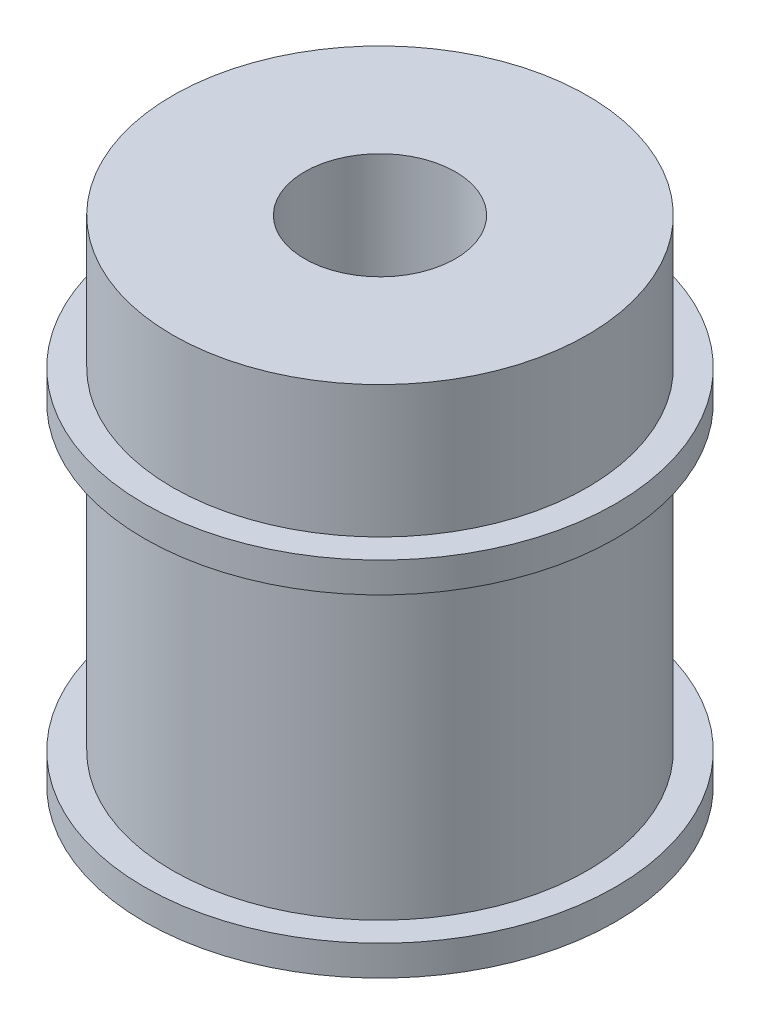
from build123d import *

# Parameters (mm, degrees)
SKETCH1_R           = 12.5
BOSS_EXTRUDE1_DEPTH = 1.6
SKETCH2_R           = 11
BOSS_EXTRUDE2_DEPTH = 16
SKETCH3_R           = 12.5
BOSS_EXTRUDE3_DEPTH = 1.6
SKETCH4_R           = 11
BOSS_EXTRUDE4_DEPTH = 7
SKETCH5_R           = 4
CUT_EXTRUDE1_DEPTH  = 32.606012086


with BuildPart() as part:
    # Sketch1 → Boss-Extrude1 (new body)
    with BuildSketch(Plane(origin=(0, 0, 0), x_dir=(1, 0, 0), z_dir=(0, 1, 0))):
        Circle(SKETCH1_R)
    extrude(amount=BOSS_EXTRUDE1_DEPTH)

    # Sketch2 → Boss-Extrude2 (add)
    with BuildSketch(Plane(origin=(0, 1.6, 0), x_dir=(1, 0, 0), z_dir=(0, 1, 0))):
        Circle(SKETCH2_R)
    extrude(amount=BOSS_EXTRUDE2_DEPTH)

    # Sketch3 → Boss-Extrude3 (add)
    with BuildSketch(Plane(origin=(0, 17.6, 0), x_dir=(1, 0, 0), z_dir=(0, 1, 0))):
        Circle(SKETCH3_R)
    extrude(amount=BOSS_EXTRUDE3_DEPTH)

    # Sketch4 → Boss-Extrude4 (add)
    with BuildSketch(Plane(origin=(0, 19.2, 0), x_dir=(1, 0, 0), z_dir=(0, 1, 0))):
        Circle(SKETCH4_R)
    extrude(amount=BOSS_EXTRUDE4_DEPTH)

    # Sketch5 → Cut-Extrude1 (cut, through all)
    with BuildSketch(Plane.XZ):
        Circle(SKETCH5_R)
    extrude(amount=-CUT_EXTRUDE1_DEPTH, mode=Mode.SUBTRACT)


solid = part.part
